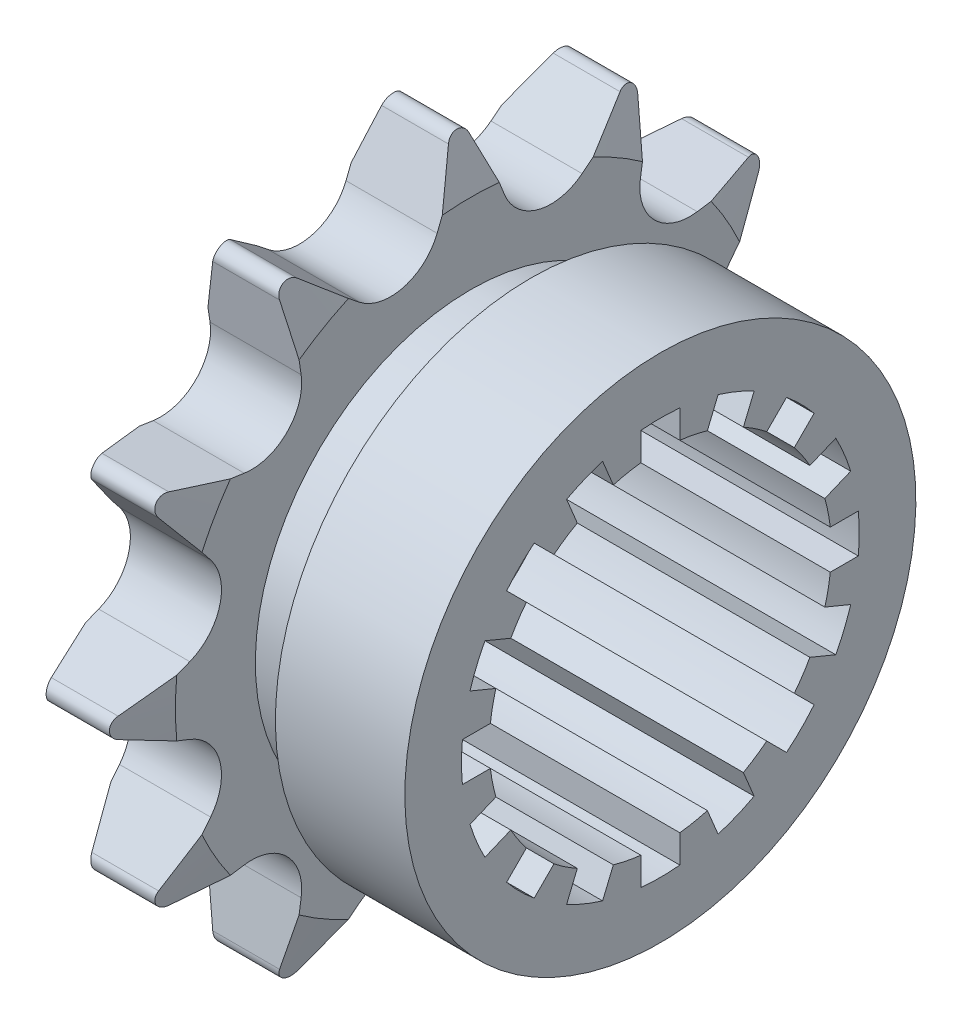
from build123d import *

# Parameters (mm, degrees)
SKETCH13_W         = 22.225
SKETCH13_H         = 27.5082
CUT_EXTRUDE1_DEPTH = 7.2136
CIRPATTERN1_COUNT  = 12
SKETCH15_W         = 127
SKETCH15_H         = 22.5171
SKETCH16_W         = 4.7625
SKETCH16_H         = 3.175
CUT_EXTRUDE2_START = -22.225
CUT_EXTRUDE2_DEPTH = 22.225


# Read off the part's stored shape, not the designer's step: Cut-Extrude2
with BuildPart() as part:
    # Sketch13 → Revolve1 (revolve)
    with BuildSketch(Plane.XY):
        with Locations((11.1125, 13.7541)):
            Rectangle(SKETCH13_W, SKETCH13_H)
    revolve(axis=Axis((0, 0, 0), (-1, 0, 0)))

    # Sketch6 → Cut-Extrude1 (cut)
    with BuildSketch(Plane(origin=(0, -16.51, 0), x_dir=(0, 0, -1), z_dir=(1, 0, 0))):
        with BuildLine():
            Line((-0.805715716, 43.469749783), (-2.663822441, 38.756002806))
            ThreePointArc((-2.663822441, 38.756002806), (-5.324614334, 36.381731224), (-8.816063498, 37.107514783))
            Line((-8.816063498, 37.107514783), (-12.782104613, 40.260686049))
            ThreePointArc((-12.782104613, 40.260686049), (-13.256994885, 40.44645554), (-13.7541, 40.332800012))
            ThreePointArc((-13.7541, 40.332800012), (-7.119646056, 43.080880815), (0, 44.0182))
            ThreePointArc((0, 44.0182), (-0.487333422, 43.868076017), (-0.805715716, 43.469749783))
        make_face()
    cut_extrude1 = extrude(amount=CUT_EXTRUDE1_DEPTH, mode=Mode.SUBTRACT)

    # CirPattern1: Cut-Extrude1 ×12 about axis
    cirpattern1_axis = Axis((0, 0, 0), (1, 0, 0))
    for i in range(1, CIRPATTERN1_COUNT):
        add(cut_extrude1.rotate(cirpattern1_axis, i * 360 / CIRPATTERN1_COUNT), mode=Mode.SUBTRACT)

    # Sketch15 → hub Cut-Revolve3 (revolve, cut)
    with BuildSketch(Plane.XY):
        with Locations((70.7136, 31.48965)):
            Rectangle(SKETCH15_W, SKETCH15_H)
        with Locations((-63.5, 31.48965)):
            Rectangle(SKETCH15_W, SKETCH15_H)
    revolve(axis=Axis((0, 0, 0), (-1, 0, 0)), mode=Mode.SUBTRACT)

    # Sketch4 → Teeth Chamfer (revolve, cut)
    with BuildSketch(Plane.XY):
        Polygon((0, 27.5082), (1.104501883, 27.5082), (0, 23.386142857), align=None)
        Polygon((7.2136, 27.5082), (6.109098117, 27.5082), (7.2136, 23.386142857), align=None)
    revolve(axis=Axis((0, 0, 0), (-1, 0, 0)), mode=Mode.SUBTRACT)

    # Sketch16 → Recess (revolve, cut)
    with BuildSketch(Plane.XY):
        with Locations((9.59485, 18.6436)):
            Rectangle(SKETCH16_W, SKETCH16_H)
    revolve(axis=Axis((0, 0, 0), (-1, 0, 0)), mode=Mode.SUBTRACT)

    # Cut-Extrude2 outline → Cut-Extrude2 (cut)
    with BuildSketch(Plane.ZY.offset(CUT_EXTRUDE2_START)):
        with BuildLine():
            ThreePointArc((1.543304, 15.672195659), (0, 15.748), (-1.543304, 15.672195659))
            Line((-1.543304, 15.672195659), (-1.543304, 13.455060235))
            ThreePointArc((-1.543304, 13.455060235), (-2.642162856, 13.283049672), (-3.723201655, 13.021451632))
            Line((-3.723201655, 13.021451632), (-4.571663291, 15.069817476))
            ThreePointArc((-4.571663291, 15.069817476), (-6.026499003, 14.54925475), (-7.423316605, 13.888623927))
            Line((-7.423316605, 13.888623927), (-6.574855611, 11.840257888))
            ThreePointArc((-6.574855611, 11.840257888), (-7.524243225, 11.260825771), (-8.422883609, 10.605445057))
            Line((-8.422883609, 10.605445057), (-9.990636235, 12.173195621))
            ThreePointArc((-9.990636235, 12.173195621), (-11.135518108, 11.135517072), (-12.17319655, 9.990635102))
            Line((-12.17319655, 9.990635102), (-10.605445057, 8.422883609))
            ThreePointArc((-10.605445057, 8.422883609), (-11.260825771, 7.524243225), (-11.840257888, 6.574855611))
            Line((-11.840257888, 6.574855611), (-13.888624887, 7.423314809))
            ThreePointArc((-13.888624887, 7.423314809), (-14.549255268, 6.026497752), (-15.06981767, 4.571662649))
            Line((-15.06981767, 4.571662649), (-13.021451632, 3.723201655))
            ThreePointArc((-13.021451632, 3.723201655), (-13.283049672, 2.642162856), (-13.455060235, 1.543304))
            Line((-13.455060235, 1.543304), (-15.672195884, 1.543301712))
            ThreePointArc((-15.672195884, 1.543301712), (-15.748, -1.15e-06), (-15.672195659, -1.543304))
            Line((-15.672195659, -1.543304), (-13.455060235, -1.543304))
            ThreePointArc((-13.455060235, -1.543304), (-13.283049672, -2.642162856), (-13.021451632, -3.723201655))
            Line((-13.021451632, -3.723201655), (-15.06981767, -4.571662649))
            ThreePointArc((-15.06981767, -4.571662649), (-14.549254488, -6.026499634), (-13.888622966, -7.423318402))
            Line((-13.888622966, -7.423318402), (-11.840257888, -6.574855611))
            ThreePointArc((-11.840257888, -6.574855611), (-11.260825771, -7.524243225), (-10.605445057, -8.422883609))
            Line((-10.605445057, -8.422883609), (-12.17319655, -9.990635102))
            ThreePointArc((-12.17319655, -9.990635102), (-11.135517072, -11.135518108), (-9.99063397, -12.17319748))
            Line((-9.99063397, -12.17319748), (-8.422883609, -10.605445057))
            ThreePointArc((-8.422883609, -10.605445057), (-7.524243225, -11.260825771), (-6.574855611, -11.840257888))
            Line((-6.574855611, -11.840257888), (-7.423316605, -13.888623927))
            ThreePointArc((-7.423316605, -13.888623927), (-6.026498383, -14.549255006), (-4.571662008, -15.069817865))
            Line((-4.571662008, -15.069817865), (-3.723201655, -13.021451632))
            ThreePointArc((-3.723201655, -13.021451632), (-2.642162856, -13.283049672), (-1.543304, -13.455060235))
            Line((-1.543304, -13.455060235), (-1.543304, -15.672195659))
            ThreePointArc((-1.543304, -15.672195659), (-1.13e-07, -15.748), (1.543303775, -15.672195681))
            Line((1.543303775, -15.672195681), (1.543304, -13.455060235))
            ThreePointArc((1.543304, -13.455060235), (2.642162856, -13.283049672), (3.723201655, -13.021451632))
            Line((3.723201655, -13.021451632), (4.571662649, -15.06981767))
            ThreePointArc((4.571662649, -15.06981767), (6.02649819, -14.549255086), (7.423315645, -13.88862444))
            Line((7.423315645, -13.88862444), (6.574855611, -11.840257888))
            ThreePointArc((6.574855611, -11.840257888), (7.524243225, -11.260825771), (8.422883609, -10.605445057))
            Line((8.422883609, -10.605445057), (9.990635102, -12.17319655))
            ThreePointArc((9.990635102, -12.17319655), (11.135516958, -11.135518222), (12.173195417, -9.990636483))
            Line((12.173195417, -9.990636483), (10.605445057, -8.422883609))
            ThreePointArc((10.605445057, -8.422883609), (11.260825771, -7.524243225), (11.840257888, -6.574855611))
            Line((11.840257888, -6.574855611), (13.888623927, -7.423316605))
            ThreePointArc((13.888623927, -7.423316605), (14.549254455, -6.026499714), (15.069817029, -4.571664765))
            Line((15.069817029, -4.571664765), (13.021451632, -3.723201655))
            ThreePointArc((13.021451632, -3.723201655), (13.283049672, -2.642162856), (13.455060235, -1.543304))
            Line((13.455060235, -1.543304), (15.672195659, -1.543304))
            ThreePointArc((15.672195659, -1.543304), (15.748, -1.15e-06), (15.672195884, 1.543301712))
            Line((15.672195884, 1.543301712), (13.455060235, 1.543304))
            ThreePointArc((13.455060235, 1.543304), (13.283049672, 2.642162856), (13.021451632, 3.723201655))
            Line((13.021451632, 3.723201655), (15.069818312, 4.571660534))
            ThreePointArc((15.069818312, 4.571660534), (14.549255301, 6.026497672), (13.888623927, 7.423316605))
            Line((13.888623927, 7.423316605), (11.840257888, 6.574855611))
            ThreePointArc((11.840257888, 6.574855611), (11.260825771, 7.524243225), (10.605445057, 8.422883609))
            Line((10.605445057, 8.422883609), (12.173197683, 9.990633722))
            ThreePointArc((12.173197683, 9.990633722), (11.135518221, 11.135516959), (9.990635102, 12.17319655))
            Line((9.990635102, 12.17319655), (8.422883609, 10.605445057))
            ThreePointArc((8.422883609, 10.605445057), (7.524243225, 11.260825771), (6.574855611, 11.840257888))
            Line((6.574855611, 11.840257888), (7.423317566, 13.888623413))
            ThreePointArc((7.423317566, 13.888623413), (6.026499196, 14.54925467), (4.571662649, 15.06981767))
            Line((4.571662649, 15.06981767), (3.723201655, 13.021451632))
            ThreePointArc((3.723201655, 13.021451632), (2.642162856, 13.283049672), (1.543304, 13.455060235))
            Line((1.543304, 13.455060235), (1.543304, 15.672195659))
        make_face()
    extrude(amount=CUT_EXTRUDE2_DEPTH, mode=Mode.SUBTRACT)


solid = part.part
